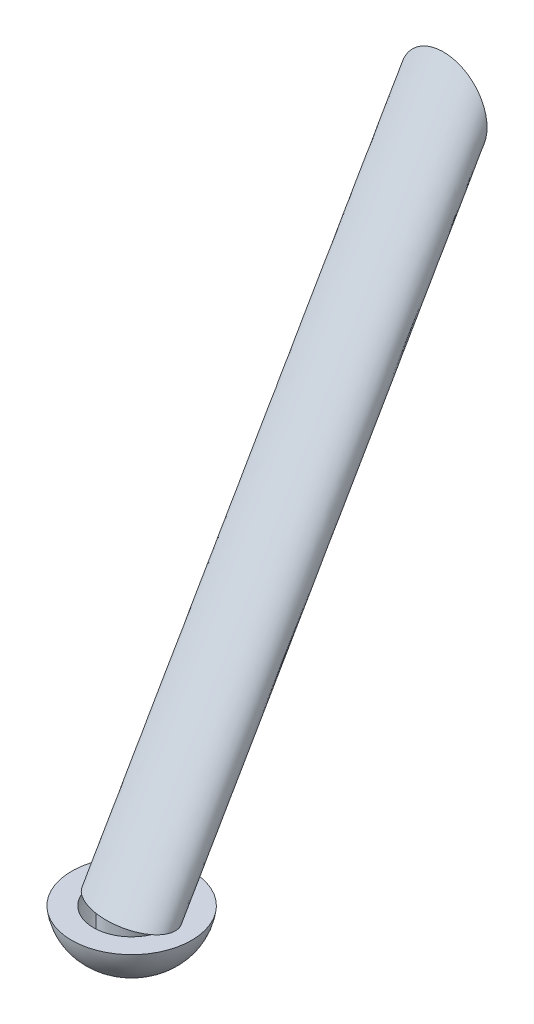
from build123d import *

# Parameters (mm, degrees)
SKETCH2_R          = 152.4
SKETCH6_R          = 415.386019323
CUT_EXTRUDE2_DEPTH = 2357.625194534


with BuildPart() as part:
    # Sweep2: sweep along a path in Sketch1
    with BuildLine(Plane(origin=(0, 0, 0), x_dir=(0, 0, -1), z_dir=(1, 0, 0))) as sweep2_path:
        Line((0, 0), (-1175.846136566, -2036.625250417))
    # Sketch2 → Sweep2 (sweep)
    with BuildSketch(Plane.XY):
        Circle(SKETCH2_R)
    sweep(path=sweep2_path.line)

    # Sketch6 → Cut-Extrude2 (cut, through all)
    with BuildSketch(Plane(origin=(0, -1884.225250417, 0), x_dir=(1, 0, 0), z_dir=(0, 1, 0))):
        with Locations((0, -1175.846136566)):
            Circle(SKETCH6_R)
    extrude(amount=-CUT_EXTRUDE2_DEPTH, mode=Mode.SUBTRACT)

    # Sketch7 → Revolve1 (revolve)
    with BuildSketch(Plane(origin=(0, 0, 0), x_dir=(0, 0, -1), z_dir=(1, 0, 0))):
        with BuildLine():
            Line((-1220.887578802, -1884.225250417), (-1297.087578802, -1884.225250417))
            ThreePointArc((-1297.087578802, -1884.225250417), (-1225.378354687, -2005.601258808), (-1087.857955542, -2036.625250417))
            Line((-1087.857955542, -2036.625250417), (-1087.857955542, -1884.225250417))
            Line((-1087.857955542, -1884.225250417), (-1175.846136566, -1884.225250417))
            Line((-1175.846136566, -1884.225250417), (-1175.846136566, -1975.66616445))
            ThreePointArc((-1175.846136566, -1975.66616445), (-1210.663906271, -1936.002917266), (-1220.887578802, -1884.225250417))
        make_face()
    revolve(axis=Axis((0, -1884.225250417, 1087.857955542), (0, -1, 0)))


solid = part.part
